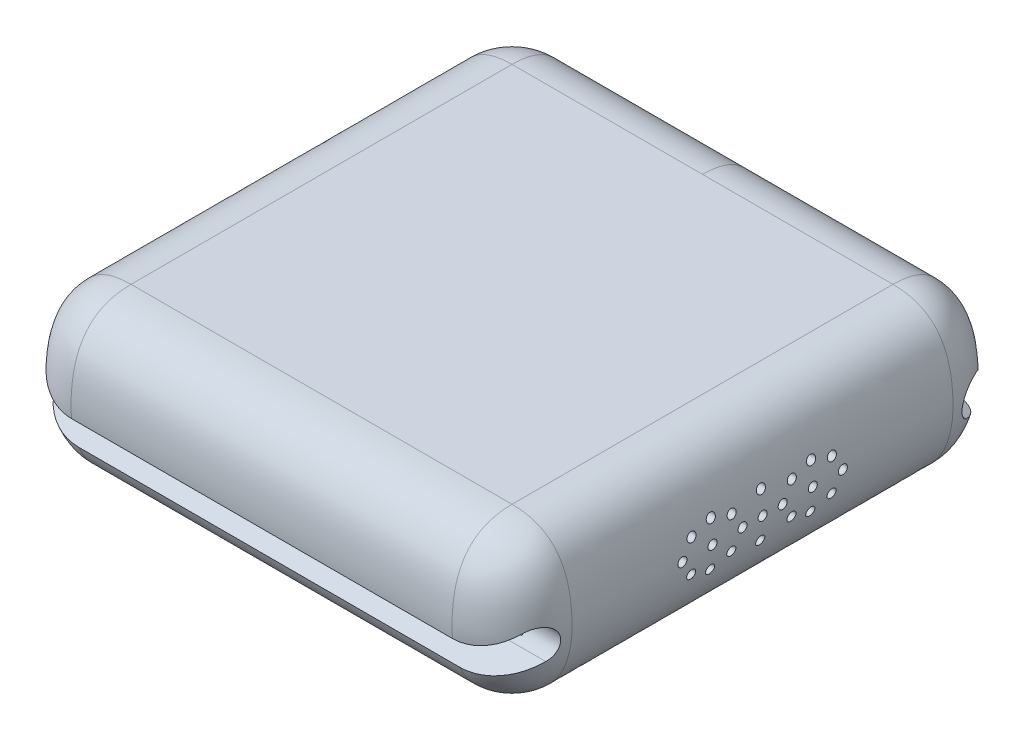
from build123d import *

# Parameters (mm, degrees)
SALIENTE_EXTRUIR1_DEPTH    = 7.5
REDONDEO2_R                = 6
REDONDEO3_R                = 6
CORTAR_EXTRUIR1_DEPTH      = 37.14208089609674
CORTAR_EXTRUIR1_DEPTH_BACK = 37.14208089609674
CROQUIS26_R                = 0.44999999999999996
CROQUIS26_R_2              = 0.45
CROQUIS26_R_3              = 0.44999999999999973
CROQUIS26_R_4              = 0.4500000000000001
CROQUIS26_R_5              = 0.4499999999999998
CROQUIS26_R_6              = 0.4500000000000002
CORTAR_EXTRUIR2_DEPTH      = 37.72606172733474
CORTAR_EXTRUIR3_DEPTH      = 5
CROQUIS52_R                = 10
CORTAR_EXTRUIR5_DEPTH      = 4


with BuildPart() as part:
    # Croquis2 → Saliente-Extruir1 (new, symmetric)
    with BuildSketch(Plane(origin=(0, 0, 0), x_dir=(1, 0, 0), z_dir=(0, 1, 0))):
        Polygon((25.000000000000004, -25), (-24.999999999999996, -25.000000000000007), (-24.999999999999996, 24.999999999999993), (25.000000000000004, 25.000000000000004), align=None)
    extrude(amount=SALIENTE_EXTRUIR1_DEPTH, both=True)

    # Redondeo2
    redondeo2_edges = [part.edges().sort_by_distance(p)[0] for p in [
        (-24.999999999999996, 0, -24.999999999999993),
    ]]
    fillet(redondeo2_edges, radius=REDONDEO2_R)

    # Redondeo3
    redondeo3_edges = [part.edges().sort_by_distance(p)[0] for p in [
        (-24.999999999999996, 0, 25.000000000000007),
        (25.000000000000004, 0, 25),
        (25.000000000000004, 0, -25.000000000000004),
    ]]
    fillet(redondeo3_edges, radius=REDONDEO3_R)

    # Cortar-Barrer11: sweep along a path in Croquis23
    with BuildLine(Plane(origin=(0, 0, 0), x_dir=(1, 0, 0), z_dir=(0, 1, 0))) as cortar_barrer11_path:
        Line((25.000000000000004, 19.000000000000004), (25.000000000000004, -19.000000000000004))
        ThreePointArc((25.000000000000004, -19.000000000000004), (23.242640687119287, -23.242640687119284), (19.000000000000004, -25))
        Line((19.000000000000004, -25), (-18.999999999999993, -25.000000000000007))
        ThreePointArc((-18.999999999999993, -25.000000000000007), (-23.24264068711928, -23.242640687119298), (-24.999999999999996, -19.00000000000001))
        Line((-24.999999999999996, -19.00000000000001), (-24.999999999999996, 18.999999999999996))
        ThreePointArc((-24.999999999999996, 18.999999999999996), (-23.242640687119277, 23.24264068711928), (-18.999999999999993, 24.999999999999993))
        Line((-18.999999999999993, 24.999999999999993), (19.000000000000004, 25.000000000000004))
        ThreePointArc((19.000000000000004, 25.000000000000004), (23.24264068711929, 23.242640687119287), (25.000000000000004, 19.000000000000004))
    # Croquis8 → Cortar-Barrer11 (sweep, cut)
    with BuildSketch(Plane(origin=(0, 0, 0), x_dir=(0, 0, -1), z_dir=(1, 0, 0))):
        with BuildLine():
            Line((19.000000000000004, -7.5), (26.548323380689034, -7.5))
            Line((26.548323380689034, -7.5), (26.548323380689034, 7.5))
            Line((26.548323380689034, 7.5), (19.000000000000004, 7.5))
            add(Edge.make_bspline(
                [(19.000000000000004, 7.5), (24.144999999999992, 7.5), (24.979624999999988, 2.4060833333333296), (25.039625000000026, -2.4060833333333296), (23.544999999999582, -7.500000000000002), (19.000000000000004, -7.5)],
                knots=[0, 0, 0, 0, 0.45, 0.55, 1, 1, 1, 1], degree=3))
        make_face()
    sweep(path=cortar_barrer11_path.line, mode=Mode.SUBTRACT)

    # Croquis26 → Cortar-Extruir1 (cut, two sides: drawn at the far end of the back side and taken through both)
    with BuildSketch(Plane(origin=(0, 0, 0), x_dir=(0, 0, -1), z_dir=(1, 0, 0)).offset(-CORTAR_EXTRUIR1_DEPTH_BACK)):
        with Locations((-2, 0)):
            Circle(CROQUIS26_R)
        Circle(CROQUIS26_R_2)
        with Locations((2, 2.4e-16)):
            Circle(CROQUIS26_R_3)
        with Locations((-4.999999999999999, 2.241379310344825)):
            Circle(CROQUIS26_R_4)
        with Locations((-3, 1.625)):
            Circle(CROQUIS26_R_5)
        with Locations((3, 1.625)):
            Circle(CROQUIS26_R_5)
        with Locations((5.000000000000001, 2.241379310344828)):
            Circle(CROQUIS26_R_4)
        with Locations((-5.000000000000001, -2.241379310344828)):
            Circle(CROQUIS26_R_4)
        with Locations((-3, -1.625)):
            Circle(CROQUIS26_R_5)
        with Locations((3, -1.625)):
            Circle(CROQUIS26_R_5)
        with Locations((5.000000000000001, -2.241379310344828)):
            Circle(CROQUIS26_R_4)
        with Locations((8.7e-16, 2.2413793103448265)):
            Circle(CROQUIS26_R)
        with Locations((0, -2.241379310344828)):
            Circle(CROQUIS26_R)
        with Locations((5, 2.4e-16)):
            Circle(CROQUIS26_R_6)
        with Locations((-5, -2.4e-16)):
            Circle(CROQUIS26_R_6)
        with Locations((-7, 1.625)):
            Circle(CROQUIS26_R_6)
        with Locations((-7, -1.625)):
            Circle(CROQUIS26_R_6)
        with Locations((-8, -3.7e-16)):
            Circle(CROQUIS26_R_6)
        with Locations((7, 1.6250000000000009)):
            Circle(CROQUIS26_R_6)
        with Locations((7, -1.625)):
            Circle(CROQUIS26_R_6)
        with Locations((8, 0)):
            Circle(CROQUIS26_R_6)
    extrude(amount=CORTAR_EXTRUIR1_DEPTH + CORTAR_EXTRUIR1_DEPTH_BACK, mode=Mode.SUBTRACT)

    # Croquis41 → Revolución1 (revolve)
    with BuildSketch(Plane(origin=(0, 0, 0), x_dir=(0, 0, -1), z_dir=(1, 0, 0))):
        with BuildLine():
            Line((0, -7.000000000000003), (-3.49e-15, -9.939999999999996))
            ThreePointArc((-3.49e-15, -9.939999999999996), (-6.429961119633624, -9.538439929078095), (-12.759999999999994, -8.34))
            Line((-12.759999999999994, -8.34), (-13.3, -7.800000000000003))
            Line((-13.3, -7.800000000000003), (-13.3, -7.000000000000003))
            Line((-13.3, -7.000000000000003), (0, -7.000000000000003))
        make_face()
    revolve(axis=Axis((0, -7.000000000000003, 0), (0, -1, 1.19e-15)))

    # Croquis42 → Cortar-Extruir2 (cut, symmetric)
    with BuildSketch(Plane(origin=(0, 0, 0), x_dir=(0, 0, -1), z_dir=(1, 0, 0))):
        with BuildLine():
            Line((-27.408862124514542, -2.953841314680872), (-22.731440640896885, 0.4896133894560955))
            ThreePointArc((-22.731440640896885, 0.4896133894560955), (-20.2663996354295, -0.00384528890572433), (-20.987968136362657, -2.4120121278824858))
            Line((-20.987968136362657, -2.4120121278824858), (-26.224274552221413, -4.925326106295731))
            Line((-26.224274552221413, -4.925326106295731), (-27.408862124514542, -2.953841314680872))
        make_face()
    cortar_extruir2 = extrude(amount=CORTAR_EXTRUIR2_DEPTH, both=True, mode=Mode.SUBTRACT)

    # Simetría5: Cortar-Extruir2 across plane
    add(cortar_extruir2.mirror(Plane.XY), mode=Mode.SUBTRACT)

    # Croquis51 → Cortar-Extruir3 (cut, symmetric)
    with BuildSketch(Plane(origin=(0, 0, 0), x_dir=(1, 0, 0), z_dir=(0, 1, 0))):
        Polygon((21.3894795652724, 20.4), (21.389479565272403, -20.4), (-21.389479562998773, -20.40000000000001), (-21.389479562998776, 20.399999999999995), align=None)
    extrude(amount=CORTAR_EXTRUIR3_DEPTH, both=True, mode=Mode.SUBTRACT)

    # Croquis52 → Cortar-Extruir5 (cut)
    with BuildSketch(Plane(origin=(0, -5, 0), x_dir=(1, 0, 0), z_dir=(0, 1, 0))):
        Circle(CROQUIS52_R)
    extrude(amount=-CORTAR_EXTRUIR5_DEPTH, mode=Mode.SUBTRACT)


with BuildPart() as cortar_extruir5_piece_1:
    # of the separate pieces the step leaves, piece 1, a body of its own (cortar_extruir5_pieces)
    add(part.part.solids().sort_by_distance((-19, 7.5, -19))[0])


with BuildPart() as cortar_extruir5_piece_2:
    # of the separate pieces the step leaves, piece 2, a body of its own (cortar_extruir5_pieces)
    add(part.part.solids().sort_by_distance((0, -9.94, 0))[0])


solid = Compound([cortar_extruir5_piece_1.part, cortar_extruir5_piece_2.part])
